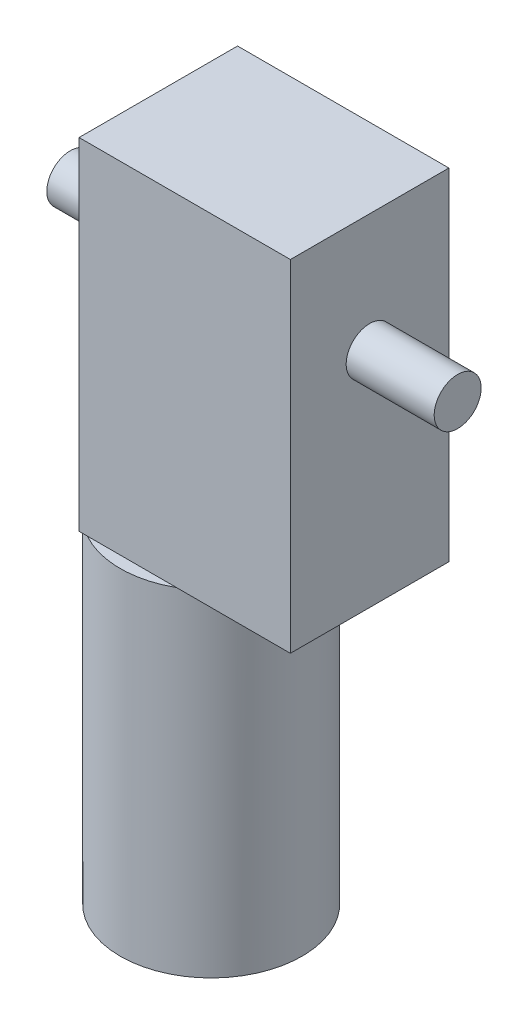
from build123d import *

# Parameters (mm, degrees)
SKETCH2_R                = 15.494
BOSS_EXTRUDE1_DEPTH      = 57.2
SKETCH3_W                = 36
SKETCH3_H                = 27
BOSS_EXTRUDE2_DEPTH      = 58.1
BOSS_EXTRUDE3_DEPTH      = 15
BOSS_EXTRUDE3_DEPTH_BACK = 51
SKETCH4_R                = 4


with BuildPart() as part:
    # Sketch2 → Boss-Extrude1 (new body)
    with BuildSketch(Plane(origin=(0, 0, 0), x_dir=(1, 0, 0), z_dir=(0, 1, 0))):
        Circle(SKETCH2_R)
    extrude(amount=BOSS_EXTRUDE1_DEPTH)

    # Sketch3 → Boss-Extrude2 (add)
    with BuildSketch(Plane(origin=(0, 57.2, 0), x_dir=(1, 0, 0), z_dir=(0, 1, 0))):
        with Locations((9, 0)):
            Rectangle(SKETCH3_W, SKETCH3_H)
    extrude(amount=BOSS_EXTRUDE2_DEPTH)

    # Sketch4 → Boss-Extrude3 (add, two sides: drawn at the far end of the back side and taken through both)
    with BuildSketch(Plane(origin=(27, 0, 0), x_dir=(0, 0, -1), z_dir=(1, 0, 0)).offset(-BOSS_EXTRUDE3_DEPTH_BACK)):
        with Locations((0, 95.1)):
            Circle(SKETCH4_R)
    extrude(amount=BOSS_EXTRUDE3_DEPTH + BOSS_EXTRUDE3_DEPTH_BACK)


solid = part.part
